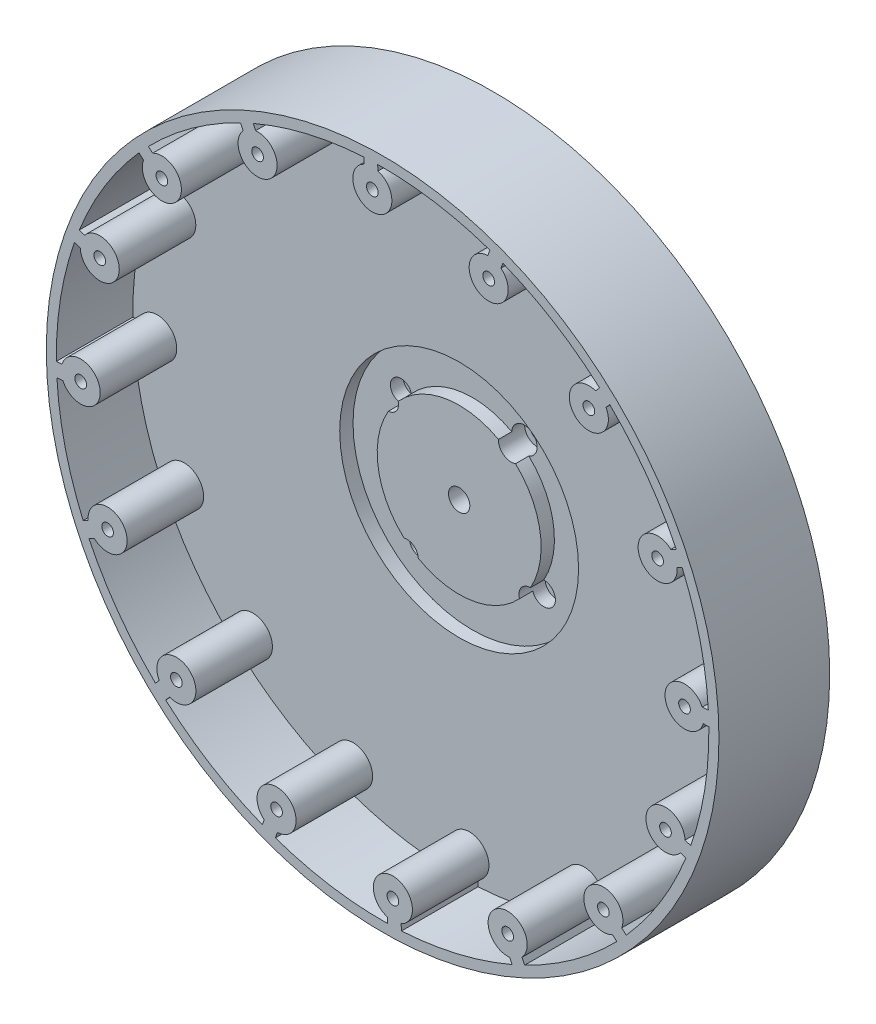
from build123d import *

# Parameters (mm, degrees)
BOSS_EXTRUDE1_START       = -929.943171
SKETCH2_R                 = 4.85
BOSS_EXTRUDE1_DEPTH       = 19.000001
BOSS_EXTRUDE1_2_DEPTH     = 19.000001
BOSS_EXTRUDE1_3_DEPTH     = 19.000001
BOSS_EXTRUDE1_4_DEPTH     = 19.000001
BOSS_EXTRUDE1_5_DEPTH     = 19.000001
BOSS_EXTRUDE1_6_DEPTH     = 19.000001
BOSS_EXTRUDE1_7_DEPTH     = 19.000001
BOSS_EXTRUDE1_8_DEPTH     = 19.000001
BOSS_EXTRUDE1_9_DEPTH     = 19.000001
BOSS_EXTRUDE1_10_DEPTH    = 19.000001
BOSS_EXTRUDE1_11_DEPTH    = 19.000001
BOSS_EXTRUDE1_12_DEPTH    = 19.000001
BOSS_EXTRUDE1_13_DEPTH    = 19.000001
BOSS_EXTRUDE1_14_DEPTH    = 19.000001
BOSS_EXTRUDE1_15_DEPTH    = 19.000001
BOSS_EXTRUDE1_16_DEPTH    = 19.000001
BOSS_EXTRUDE2_START       = -936.335976185
BOSS_EXTRUDE2_OUTLINE_R   = 83.5
BOSS_EXTRUDE2_OUTLINE_R_2 = 81
BOSS_EXTRUDE2_DEPTH       = 19
SKETCH4_R                 = 83.5
BOSS_EXTRUDE5_DEPTH       = 8.5
CUT_EXTRUDE1_REACH        = 163.395
SKETCH5_R                 = 2.65
SKETCH6_R                 = 11.25
CUT_EXTRUDE2_DEPTH        = 2
SKETCH7_R                 = 29.65
SKETCH7_R_2               = 20.35
CUT_EXTRUDE3_DEPTH        = 3.3
CUT_EXTRUDE4_START        = -27.5
SKETCH8_R                 = 1.45
CUT_EXTRUDE4_DEPTH        = 189.894533619
BOSS_EXTRUDE6_DEPTH       = 19
CUT_EXTRUDE5_REACH        = 163.395
SKETCH10_R                = 1.6
SKETCH11_R                = 2.75
SKETCH11_R_2              = 2.65777137
SKETCH11_R_3              = 3.155373174
SKETCH11_R_4              = 2.875710844
CUT_EXTRUDE6_DEPTH        = 6.5


# Read off the part's stored shape, not the designer's step: Boss-Extrude2, Boss-Extrude6
with BuildPart() as part:
    # Sketch2 → Boss-Extrude1 (new body)
    with BuildSketch(Plane(origin=(-20.142161583, -37.124408079, -6.39280563), x_dir=(0.9505174142276077, -0.3106712816628898, 0), z_dir=(0, 0, 1)).offset(BOSS_EXTRUDE1_START)):
        with Locations(Location((31.639459874, 67.999592491, 0), (0, 0, 198.099689688))):
            Circle(SKETCH2_R)
    extrude(amount=BOSS_EXTRUDE1_DEPTH)



with BuildPart() as body_2:
    # Sketch2 → Boss-Extrude1 2 (new body)
    with BuildSketch(Plane(origin=(-20.142161583, -37.124408079, -6.39280563), x_dir=(0.9505174142276077, -0.3106712816628898, 0), z_dir=(0, 0, 1)).offset(BOSS_EXTRUDE1_START)):
        with Locations(Location((55.253366851, 50.715534618, 0), (0, 0, 198.099689688))):
            Circle(SKETCH2_R)
    extrude(amount=BOSS_EXTRUDE1_2_DEPTH)


with BuildPart() as body_3:
    # Sketch2 → Boss-Extrude1 3 (new body)
    with BuildSketch(Plane(origin=(-20.142161583, -37.124408079, -6.39280563), x_dir=(0.9505174142276077, -0.3106712816628898, 0), z_dir=(0, 0, 1)).offset(BOSS_EXTRUDE1_START)):
        with Locations(Location((70.455449598, 25.710496338, 0), (0, 0, 198.099689688))):
            Circle(SKETCH2_R)
    extrude(amount=BOSS_EXTRUDE1_3_DEPTH)


with BuildPart() as body_4:
    # Sketch2 → Boss-Extrude1 4 (new body)
    with BuildSketch(Plane(origin=(-20.142161583, -37.124408079, -6.39280563), x_dir=(0.9505174142276077, -0.3106712816628898, 0), z_dir=(0, 0, 1)).offset(BOSS_EXTRUDE1_START)):
        with Locations(Location((74.931328824, -3.208731944, 0), (0, 0, 198.099689688))):
            Circle(SKETCH2_R)
    extrude(amount=BOSS_EXTRUDE1_4_DEPTH)


with BuildPart() as body_5:
    # Sketch2 → Boss-Extrude1 5 (new body)
    with BuildSketch(Plane(origin=(-20.142161583, -37.124408079, -6.39280563), x_dir=(0.9505174142276077, -0.3106712816628898, 0), z_dir=(0, 0, 1)).offset(BOSS_EXTRUDE1_START)):
        with Locations(Location((67.999592491, -31.639459874, 0), (0, 0, 198.099689688))):
            Circle(SKETCH2_R)
    extrude(amount=BOSS_EXTRUDE1_5_DEPTH)


with BuildPart() as body_6:
    # Sketch2 → Boss-Extrude1 6 (new body)
    with BuildSketch(Plane(origin=(-20.142161583, -37.124408079, -6.39280563), x_dir=(0.9505174142276077, -0.3106712816628898, 0), z_dir=(0, 0, 1)).offset(BOSS_EXTRUDE1_START)):
        with Locations(Location((50.715534618, -55.253366851, 0), (0, 0, 198.099689688))):
            Circle(SKETCH2_R)
    extrude(amount=BOSS_EXTRUDE1_6_DEPTH)


with BuildPart() as body_7:
    # Sketch2 → Boss-Extrude1 7 (new body)
    with BuildSketch(Plane(origin=(-20.142161583, -37.124408079, -6.39280563), x_dir=(0.9505174142276077, -0.3106712816628898, 0), z_dir=(0, 0, 1)).offset(BOSS_EXTRUDE1_START)):
        with Locations(Location((25.710496338, -70.455449598, 0), (0, 0, 198.099689688))):
            Circle(SKETCH2_R)
    extrude(amount=BOSS_EXTRUDE1_7_DEPTH)


with BuildPart() as body_8:
    # Sketch2 → Boss-Extrude1 8 (new body)
    with BuildSketch(Plane(origin=(-20.142161583, -37.124408079, -6.39280563), x_dir=(0.9505174142276077, -0.3106712816628898, 0), z_dir=(0, 0, 1)).offset(BOSS_EXTRUDE1_START)):
        with Locations(Location((-3.208731944, -74.931328824, 0), (0, 0, 198.099689688))):
            Circle(SKETCH2_R)
    extrude(amount=BOSS_EXTRUDE1_8_DEPTH)


with BuildPart() as body_9:
    # Sketch2 → Boss-Extrude1 9 (new body)
    with BuildSketch(Plane(origin=(-20.142161583, -37.124408079, -6.39280563), x_dir=(0.9505174142276077, -0.3106712816628898, 0), z_dir=(0, 0, 1)).offset(BOSS_EXTRUDE1_START)):
        with Locations(Location((-31.639459874, -67.999592491, 0), (0, 0, 198.099689688))):
            Circle(SKETCH2_R)
    extrude(amount=BOSS_EXTRUDE1_9_DEPTH)


with BuildPart() as body_10:
    # Sketch2 → Boss-Extrude1 10 (new body)
    with BuildSketch(Plane(origin=(-20.142161583, -37.124408079, -6.39280563), x_dir=(0.9505174142276077, -0.3106712816628898, 0), z_dir=(0, 0, 1)).offset(BOSS_EXTRUDE1_START)):
        with Locations(Location((-55.253366851, -50.715534618, 0), (0, 0, 198.099689688))):
            Circle(SKETCH2_R)
    extrude(amount=BOSS_EXTRUDE1_10_DEPTH)


with BuildPart() as body_11:
    # Sketch2 → Boss-Extrude1 11 (new body)
    with BuildSketch(Plane(origin=(-20.142161583, -37.124408079, -6.39280563), x_dir=(0.9505174142276077, -0.3106712816628898, 0), z_dir=(0, 0, 1)).offset(BOSS_EXTRUDE1_START)):
        with Locations(Location((-70.455449598, -25.710496338, 0), (0, 0, 198.099689688))):
            Circle(SKETCH2_R)
    extrude(amount=BOSS_EXTRUDE1_11_DEPTH)


with BuildPart() as body_12:
    # Sketch2 → Boss-Extrude1 12 (new body)
    with BuildSketch(Plane(origin=(-20.142161583, -37.124408079, -6.39280563), x_dir=(0.9505174142276077, -0.3106712816628898, 0), z_dir=(0, 0, 1)).offset(BOSS_EXTRUDE1_START)):
        with Locations(Location((-74.931328824, 3.208731944, 0), (0, 0, 198.099689688))):
            Circle(SKETCH2_R)
    extrude(amount=BOSS_EXTRUDE1_12_DEPTH)


with BuildPart() as body_13:
    # Sketch2 → Boss-Extrude1 13 (new body)
    with BuildSketch(Plane(origin=(-20.142161583, -37.124408079, -6.39280563), x_dir=(0.9505174142276077, -0.3106712816628898, 0), z_dir=(0, 0, 1)).offset(BOSS_EXTRUDE1_START)):
        with Locations(Location((-67.999592491, 31.639459874, 0), (0, 0, 198.099689688))):
            Circle(SKETCH2_R)
    extrude(amount=BOSS_EXTRUDE1_13_DEPTH)


with BuildPart() as body_14:
    # Sketch2 → Boss-Extrude1 14 (new body)
    with BuildSketch(Plane(origin=(-20.142161583, -37.124408079, -6.39280563), x_dir=(0.9505174142276077, -0.3106712816628898, 0), z_dir=(0, 0, 1)).offset(BOSS_EXTRUDE1_START)):
        with Locations(Location((-50.715534618, 55.253366851, 0), (0, 0, 198.099689688))):
            Circle(SKETCH2_R)
    extrude(amount=BOSS_EXTRUDE1_14_DEPTH)


with BuildPart() as body_15:
    # Sketch2 → Boss-Extrude1 15 (new body)
    with BuildSketch(Plane(origin=(-20.142161583, -37.124408079, -6.39280563), x_dir=(0.9505174142276077, -0.3106712816628898, 0), z_dir=(0, 0, 1)).offset(BOSS_EXTRUDE1_START)):
        with Locations(Location((-25.710496338, 70.455449598, 0), (0, 0, 198.099689688))):
            Circle(SKETCH2_R)
    extrude(amount=BOSS_EXTRUDE1_15_DEPTH)


with BuildPart() as body_16:
    # Sketch2 → Boss-Extrude1 16 (new body)
    with BuildSketch(Plane(origin=(-20.142161583, -37.124408079, -6.39280563), x_dir=(0.9505174142276077, -0.3106712816628898, 0), z_dir=(0, 0, 1)).offset(BOSS_EXTRUDE1_START)):
        with Locations(Location((3.208731944, 74.931328824, 0), (0, 0, 198.099689688))):
            Circle(SKETCH2_R)
    extrude(amount=BOSS_EXTRUDE1_16_DEPTH)


with BuildPart() as body_17:
    # Boss-Extrude2 outline → Boss-Extrude2 (new body)
    with BuildSketch(Plane.XY.offset(BOSS_EXTRUDE2_START)):
        with Locations((-20.142161583, -37.124408079)):
            Circle(BOSS_EXTRUDE2_OUTLINE_R)
        with Locations((-20.142161583, -37.124408079)):
            Circle(BOSS_EXTRUDE2_OUTLINE_R_2, mode=Mode.SUBTRACT)
    extrude(amount=BOSS_EXTRUDE2_DEPTH)


with BuildPart() as part_1:
    add(part.part)

    add(body_2.part)  # Boss-Extrude5 merges body 2

    add(body_3.part)  # Boss-Extrude5 merges body 3

    add(body_4.part)  # Boss-Extrude5 merges body 4

    add(body_5.part)  # Boss-Extrude5 merges body 5

    add(body_6.part)  # Boss-Extrude5 merges body 6

    add(body_7.part)  # Boss-Extrude5 merges body 7

    add(body_8.part)  # Boss-Extrude5 merges body 8

    add(body_9.part)  # Boss-Extrude5 merges body 9

    add(body_10.part)  # Boss-Extrude5 merges body 10

    add(body_11.part)  # Boss-Extrude5 merges body 11

    add(body_12.part)  # Boss-Extrude5 merges body 12

    add(body_13.part)  # Boss-Extrude5 merges body 13

    add(body_14.part)  # Boss-Extrude5 merges body 14

    add(body_15.part)  # Boss-Extrude5 merges body 15

    add(body_16.part)  # Boss-Extrude5 merges body 16

    add(body_17.part)  # Boss-Extrude5 merges body 17
    # Sketch4 → Boss-Extrude5 (add)
    with BuildSketch(Plane(origin=(0, 0, -936.335976185), x_dir=(-1, 0, 0), z_dir=(0, 0, -1))):
        with Locations(Location((20.142161583, -37.124408079, 0), (0, 0, 180))):
            Circle(SKETCH4_R)
    extrude(amount=BOSS_EXTRUDE5_DEPTH)

    # Sketch5 → Cut-Extrude1 (cut, up to next)
    with BuildSketch(Plane(origin=(0, 0, -944.835976185), x_dir=(-1, 0, 0), z_dir=(0, 0, -1)), mode=Mode.PRIVATE) as cut_extrude1_sk1:
        with Locations((20.142161583, -37.124408079)):
            Circle(SKETCH5_R)
    cut_extrude1_tool1 = extrude(cut_extrude1_sk1.sketch, amount=-CUT_EXTRUDE1_REACH, mode=Mode.PRIVATE) & part_1.part
    add(cut_extrude1_tool1.solids().sort_by_distance((-20.142162, -37.124408, -944.835976))[0], mode=Mode.SUBTRACT)

    # Sketch6 → Cut-Extrude2 (cut)
    with BuildSketch(Plane(origin=(0, 0, -944.835976185), x_dir=(-1, 0, 0), z_dir=(0, 0, -1))):
        with Locations((20.142161583, -37.124408079)):
            Circle(SKETCH6_R)
    extrude(amount=-CUT_EXTRUDE2_DEPTH, mode=Mode.SUBTRACT)

    # Sketch7 → Cut-Extrude3 (cut)
    with BuildSketch(Plane.XY.offset(-936.335976185)):
        with Locations((-20.142161583, -37.124408079)):
            Circle(SKETCH7_R)
        with Locations((-20.142161583, -37.124408079)):
            Circle(SKETCH7_R_2, mode=Mode.SUBTRACT)
    extrude(amount=-CUT_EXTRUDE3_DEPTH, mode=Mode.SUBTRACT)

    # Sketch8 → Cut-Extrude4 (cut, through all)
    with BuildSketch(Plane.XY.offset(-917.335976185).offset(CUT_EXTRUDE4_START)):
        with Locations(Location((-90.368833636, -10.795440527, 0), (0, 0, 180))):
            Circle(SKETCH8_R)
        with Locations(Location((-74.947486856, 14.074970059, 0), (0, 0, 180))):
            Circle(SKETCH8_R)
        with Locations(Location((-51.182526114, 31.150739448, 0), (0, 0, 180))):
            Circle(SKETCH8_R)
        with Locations(Location((-22.691951254, 37.83223654, 0), (0, 0, 180))):
            Circle(SKETCH8_R)
        with Locations(Location((6.186805969, 33.102263974, 0), (0, 0, 180))):
            Circle(SKETCH8_R)
        with Locations(Location((31.057216555, 17.680917193, 0), (0, 0, 180))):
            Circle(SKETCH8_R)
        with Locations(Location((48.132985943, -6.084043548, 0), (0, 0, 180))):
            Circle(SKETCH8_R)
        with Locations(Location((54.814483036, -34.574618408, 0), (0, 0, 180))):
            Circle(SKETCH8_R)
        with Locations(Location((50.084510469, -63.453375632, 0), (0, 0, 180))):
            Circle(SKETCH8_R)
        with Locations(Location((34.663163689, -88.323786218, 0), (0, 0, 180))):
            Circle(SKETCH8_R)
        with Locations(Location((10.898202947, -105.399555606, 0), (0, 0, 180))):
            Circle(SKETCH8_R)
        with Locations(Location((-17.592371912, -112.081052699, 0), (0, 0, 180))):
            Circle(SKETCH8_R)
        with Locations(Location((-46.471129136, -107.351080132, 0), (0, 0, 180))):
            Circle(SKETCH8_R)
        with Locations(Location((-71.341539722, -91.929733352, 0), (0, 0, 180))):
            Circle(SKETCH8_R)
        with Locations(Location((-88.41730911, -68.16477261, 0), (0, 0, 180))):
            Circle(SKETCH8_R)
        with Locations(Location((-95.098806203, -39.67419775, 0), (0, 0, 180))):
            Circle(SKETCH8_R)
    extrude(amount=CUT_EXTRUDE4_DEPTH, mode=Mode.SUBTRACT)

    # Boss-Extrude6 outline → Boss-Extrude6 (add)
    with BuildSketch(Plane.XY.offset(-936.335976185)):
        with BuildLine():
            Line((-96.642158021, -10.502038819), (-95.214542089, -10.999424823))
            ThreePointArc((-95.214542089, -10.999424823), (-94.970616086, -9.263742682), (-94.125686752, -7.728103789))
            Line((-94.125686752, -7.728103789), (-95.439774561, -7.27027135))
            ThreePointArc((-95.439774561, -7.27027135), (-96.058165405, -8.879756131), (-96.642158021, -10.502038819))
        make_face()
        with BuildLine():
            Line((-99.743504855, -38.278033565), (-101.132768574, -38.357931178))
            ThreePointArc((-101.132768574, -38.357931178), (-101.088164058, -40.081549155), (-101.006882175, -41.803827225))
            Line((-101.006882175, -41.803827225), (-99.497595652, -41.717027009))
            ThreePointArc((-99.497595652, -41.717027009), (-99.93645421, -40.020119365), (-99.743504855, -38.278033565))
        make_face()
        with BuildLine():
            ThreePointArc((-78.283401547, 19.272366789), (-79.470643351, 18.022044673), (-80.631002883, 16.7467352))
            Line((-80.631002883, 16.7467352), (-79.502399126, 15.740885486))
            ThreePointArc((-79.502399126, 15.740885486), (-78.612824086, 17.25110025), (-77.244547606, 18.346505136))
            Line((-77.244547606, 18.346505136), (-78.283401547, 19.272366789))
        make_face()
        with BuildLine():
            Line((-93.242740032, -68.652334317), (-94.495676855, -69.257798295))
            ThreePointArc((-94.495676855, -69.257798295), (-93.794867611, -70.833144257), (-93.06068566, -72.393216486))
            Line((-93.06068566, -72.393216486), (-91.699503737, -71.735444596))
            ThreePointArc((-91.699503737, -71.735444596), (-92.754334618, -70.335650253), (-93.242740032, -68.652334317))
        make_face()
        with BuildLine():
            ThreePointArc((-52.2755518, 37.229107192), (-53.850897762, 36.528297949), (-55.41096999, 35.794115998))
            Line((-55.41096999, 35.794115998), (-54.7531981, 34.432934075))
            ThreePointArc((-54.7531981, 34.432934075), (-53.353403758, 35.487764956), (-51.670087822, 35.97617037))
            Line((-51.670087822, 35.97617037), (-52.2755518, 37.229107192))
        make_face()
        with BuildLine():
            Line((-75.613074799, -94.226794102), (-76.538936451, -95.265648043))
            ThreePointArc((-76.538936451, -95.265648043), (-75.288614335, -96.452889847), (-74.013304863, -97.613249378))
            Line((-74.013304863, -97.613249378), (-73.007455148, -96.484645623))
            ThreePointArc((-73.007455148, -96.484645623), (-74.517669913, -95.595070582), (-75.613074799, -94.226794102))
        make_face()
        with BuildLine():
            ThreePointArc((-21.375684682, 43.866198912), (-23.099302659, 43.821594396), (-24.821580729, 43.740312513))
            Line((-24.821580729, 43.740312513), (-24.734780514, 42.231025989))
            ThreePointArc((-24.734780514, 42.231025989), (-23.037872869, 42.669884547), (-21.295787069, 42.476935192))
            Line((-21.295787069, 42.476935192), (-21.375684682, 43.866198912))
        make_face()
        with BuildLine():
            Line((-49.538465873, -111.107933249), (-49.996298312, -112.422021057))
            ThreePointArc((-49.996298312, -112.422021057), (-48.386813532, -113.040411901), (-46.764530844, -113.624404517))
            Line((-46.764530844, -113.624404517), (-46.267144839, -112.196788584))
            ThreePointArc((-46.267144839, -112.196788584), (-48.00282698, -111.952862582), (-49.538465873, -111.107933249))
        make_face()
        with BuildLine():
            ThreePointArc((9.711975146, 38.173204899), (8.102490365, 38.791595743), (6.480207677, 39.375588359))
            Line((6.480207677, 39.375588359), (5.982821672, 37.947972426))
            ThreePointArc((5.982821672, 37.947972426), (7.718503813, 37.704046424), (9.254142706, 36.859117091))
            Line((9.254142706, 36.859117091), (9.711975146, 38.173204899))
        make_face()
        with BuildLine():
            Line((-18.988536098, -116.725751351), (-18.908638485, -118.11501507))
            ThreePointArc((-18.908638485, -118.11501507), (-17.185020507, -118.070410554), (-15.462742437, -117.989128671))
            Line((-15.462742437, -117.989128671), (-15.549542653, -116.479842148))
            ThreePointArc((-15.549542653, -116.479842148), (-17.246450298, -116.918700706), (-18.988536098, -116.725751351))
        make_face()
        with BuildLine():
            ThreePointArc((36.254613285, 21.016831884), (35.004291169, 22.204073689), (33.728981696, 23.364433221))
            Line((33.728981696, 23.364433221), (32.723131982, 22.235829463))
            ThreePointArc((32.723131982, 22.235829463), (34.233346746, 21.346254423), (35.328751632, 19.977977943))
            Line((35.328751632, 19.977977943), (36.254613285, 21.016831884))
        make_face()
        with BuildLine():
            Line((11.385764655, -110.224986528), (11.991228633, -111.477923351))
            ThreePointArc((11.991228633, -111.477923351), (13.566574595, -110.777114107), (15.126646823, -110.042932156))
            Line((15.126646823, -110.042932156), (14.468874933, -108.681750233))
            ThreePointArc((14.468874933, -108.681750233), (13.069080591, -109.736581114), (11.385764655, -110.224986528))
        make_face()
        with BuildLine():
            ThreePointArc((54.211353688, -4.991017863), (53.510544445, -3.415671901), (52.776362494, -1.855599673))
            Line((52.776362494, -1.855599673), (51.41518057, -2.513371563))
            ThreePointArc((51.41518057, -2.513371563), (52.470011451, -3.913165905), (52.958416865, -5.596481841))
            Line((52.958416865, -5.596481841), (54.211353688, -4.991017863))
        make_face()
        with BuildLine():
            Line((36.960224439, -92.595321294), (37.99907838, -93.521182947))
            ThreePointArc((37.99907838, -93.521182947), (39.186320184, -92.270860831), (40.346679717, -90.995551358))
            Line((40.346679717, -90.995551358), (39.21807596, -89.989701644))
            ThreePointArc((39.21807596, -89.989701644), (38.328500919, -91.499916409), (36.960224439, -92.595321294))
        make_face()
        with BuildLine():
            ThreePointArc((60.848445408, -35.890884981), (60.803840892, -34.167267003), (60.722559009, -32.444988933))
            Line((60.722559009, -32.444988933), (59.213272485, -32.531789149))
            ThreePointArc((59.213272485, -32.531789149), (59.652131043, -34.228696794), (59.459181688, -35.970782594))
            Line((59.459181688, -35.970782594), (60.848445408, -35.890884981))
        make_face()
        with BuildLine():
            Line((53.841363586, -66.520712369), (55.155451395, -66.978544808))
            ThreePointArc((55.155451395, -66.978544808), (55.773842239, -65.369060028), (56.357834854, -63.74677734))
            Line((56.357834854, -63.74677734), (54.930218921, -63.249391335))
            ThreePointArc((54.930218921, -63.249391335), (54.686292919, -64.985073476), (53.841363586, -66.520712369))
        make_face()
    extrude(amount=BOSS_EXTRUDE6_DEPTH)

    # Sketch10 → Cut-Extrude5 (cut, up to next)
    with BuildSketch(Plane(origin=(0, 0, -944.835976185), x_dir=(-1, 0, 0), z_dir=(0, 0, -1)), mode=Mode.PRIVATE) as cut_extrude5_sk1:
        with Locations((37.860987696, -24.219246275)):
            Circle(SKETCH10_R)
    cut_extrude5_tool1 = extrude(cut_extrude5_sk1.sketch, amount=-CUT_EXTRUDE5_REACH, mode=Mode.PRIVATE) & part_1.part
    # Sketch10 → Cut-Extrude5 (cut, up to next)
    with BuildSketch(Plane(origin=(0, 0, -944.835976185), x_dir=(-1, 0, 0), z_dir=(0, 0, -1)), mode=Mode.PRIVATE) as cut_extrude5_sk2:
        with Locations((7.236999779, -19.405581967)):
            Circle(SKETCH10_R)
    cut_extrude5_tool2 = extrude(cut_extrude5_sk2.sketch, amount=-CUT_EXTRUDE5_REACH, mode=Mode.PRIVATE) & part_1.part
    # Sketch10 → Cut-Extrude5 (cut, up to next)
    with BuildSketch(Plane(origin=(0, 0, -944.835976185), x_dir=(-1, 0, 0), z_dir=(0, 0, -1)), mode=Mode.PRIVATE) as cut_extrude5_sk3:
        with Locations((2.423335471, -50.029569884)):
            Circle(SKETCH10_R)
    cut_extrude5_tool3 = extrude(cut_extrude5_sk3.sketch, amount=-CUT_EXTRUDE5_REACH, mode=Mode.PRIVATE) & part_1.part
    # Sketch10 → Cut-Extrude5 (cut, up to next)
    with BuildSketch(Plane(origin=(0, 0, -944.835976185), x_dir=(-1, 0, 0), z_dir=(0, 0, -1)), mode=Mode.PRIVATE) as cut_extrude5_sk4:
        with Locations((33.047323388, -54.843234192)):
            Circle(SKETCH10_R)
    cut_extrude5_tool4 = extrude(cut_extrude5_sk4.sketch, amount=-CUT_EXTRUDE5_REACH, mode=Mode.PRIVATE) & part_1.part
    add(cut_extrude5_tool1.solids().sort_by_distance((-37.860988, -24.219246, -944.835976))[0], mode=Mode.SUBTRACT)
    add(cut_extrude5_tool2.solids().sort_by_distance((-7.237, -19.405582, -944.835976))[0], mode=Mode.SUBTRACT)
    add(cut_extrude5_tool3.solids().sort_by_distance((-2.423335, -50.02957, -944.835976))[0], mode=Mode.SUBTRACT)
    add(cut_extrude5_tool4.solids().sort_by_distance((-33.047323, -54.843234, -944.835976))[0], mode=Mode.SUBTRACT)

    # Sketch11 → Cut-Extrude6 (cut)
    with BuildSketch(Plane.XY.offset(-936.335976185)):
        with Locations((-33.047323388, -54.843234192)):
            Circle(SKETCH11_R)
        with Locations((-37.860987696, -24.219246275)):
            Circle(SKETCH11_R_2)
        with Locations((-7.236999779, -19.405581967)):
            Circle(SKETCH11_R_3)
        with Locations((-2.423335471, -50.029569884)):
            Circle(SKETCH11_R_4)
    extrude(amount=-CUT_EXTRUDE6_DEPTH, mode=Mode.SUBTRACT)


solid = part_1.part
